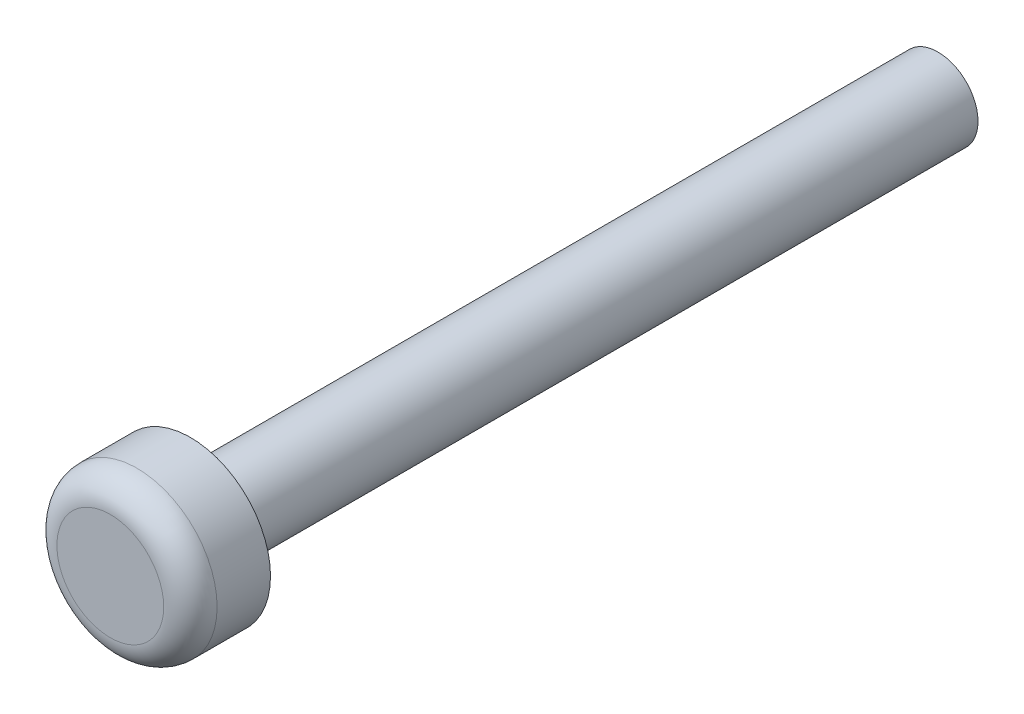
from build123d import *

# Parameters (mm, degrees)
SKETCH1_R           = 1.5
BOSS_EXTRUDE1_DEPTH = 28
SKETCH2_R           = 3
BOSS_EXTRUDE2_DEPTH = 3
FILLET1_R           = 1


with BuildPart() as part:
    # Sketch1 → Boss-Extrude1 (new body)
    with BuildSketch(Plane.XY):
        Circle(SKETCH1_R)
    extrude(amount=-BOSS_EXTRUDE1_DEPTH)

    # Sketch2 → Boss-Extrude2 (add)
    with BuildSketch(Plane.XY):
        Circle(SKETCH2_R)
    extrude(amount=BOSS_EXTRUDE2_DEPTH)

    # Fillet1
    fillet1_edges = [part.edges().sort_by_distance(p)[0] for p in [
        (-3, 0, 3),
    ]]
    fillet(fillet1_edges, radius=FILLET1_R)


solid = part.part
